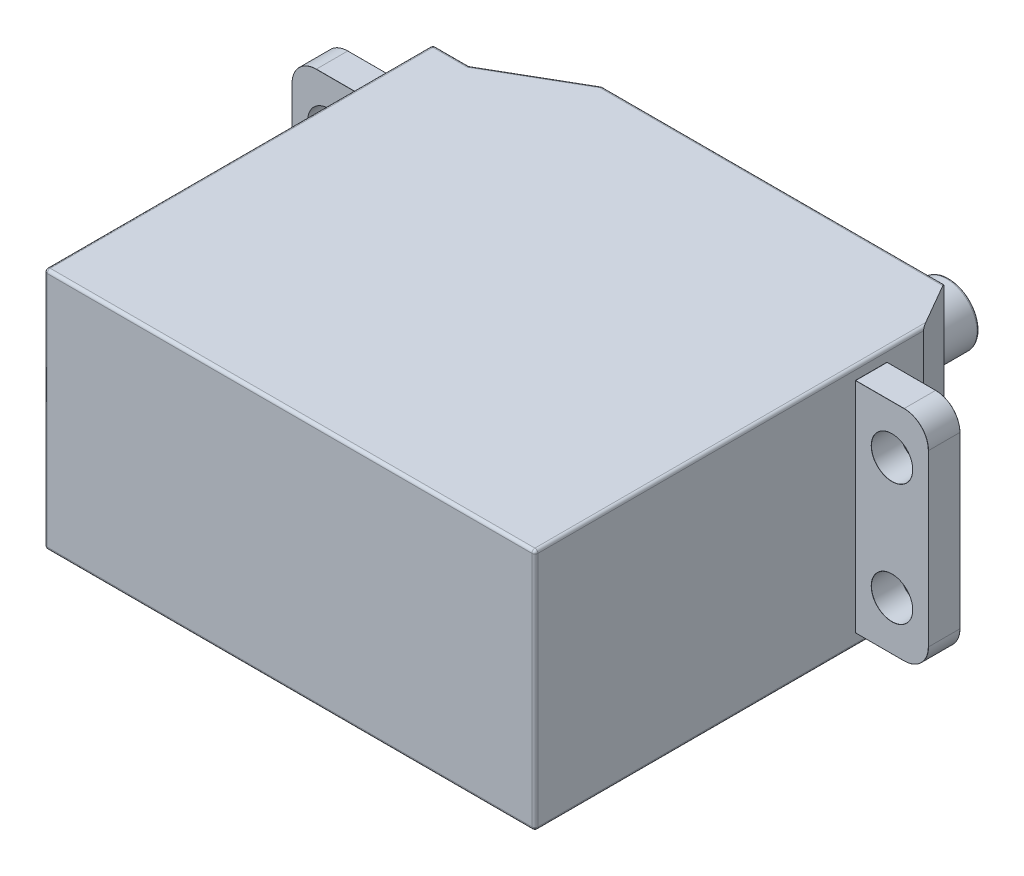
from build123d import *
from OCP.BRepFilletAPI import BRepFilletAPI_MakeChamfer

# Parameters (mm, degrees)
SKETCH_1_W      = 40.4
SKETCH_1_H      = 20
EXTRUDE_1_DEPTH = 32
EXTRUDE_2_DEPTH = 20
SKETCH_4_R      = 1.7
EXTRUDE_3_DEPTH = 2.6
EXTRUDE_4_DEPTH = 0.1
FILLET_2_R      = 0.25
RIB_1_REACH     = 59.245
SKETCH_7_WALL_W = 119.59530404
SKETCH_7_WALL_H = 2
RIB_4_REACH     = 59.245
SKETCH_8_WALL_W = 119.59530404
SKETCH_8_WALL_H = 2
CHAMFER_2_SIZE  = 0.25
CHAMFER_2_SIZE2 = 0.144337567
FILLET2_R       = 0.2
FILLET3_R       = 0.01


with BuildPart() as part:
    # 草图1 → 拉伸1 (new body)
    with BuildSketch(Plane.XY):
        with Locations((20.2, 10)):
            Rectangle(SKETCH_1_W, SKETCH_1_H)
    extrude(amount=EXTRUDE_1_DEPTH)

    # 草图3 → 拉伸2 (add)
    with BuildSketch(Plane(origin=(0, 0, 0), x_dir=(1, 0, 0), z_dir=(0, 1, 0))):
        Polygon((3, 0), (9.92820323, 4), (38.090598923, 4), (40.4, 0), align=None)
    extrude(amount=EXTRUDE_2_DEPTH)

    # 草图4 → 拉伸3 (add)
    # profile 1 of 2: a face of its own
    with BuildSketch(Plane.XY.offset(3)):
        with BuildLine():
            Line((0, 19), (-4, 19))
            ThreePointArc((-4, 19), (-5.414213562, 18.414213562), (-6, 17))
            Line((-6, 17), (-6, 3))
            ThreePointArc((-6, 3), (-5.414213562, 1.585786438), (-4, 1))
            Line((-4, 1), (0, 1))
            Line((0, 1), (0, 19))
        make_face()
        with Locations((-3, 15)):
            Circle(SKETCH_4_R, mode=Mode.SUBTRACT)
        with Locations(Location((-3, 5, 0), (0, 0, 180))):
            Circle(SKETCH_4_R, mode=Mode.SUBTRACT)
    # profile 2 of 2: a face of its own
    with BuildSketch(Plane.XY.offset(3)):
        with BuildLine():
            Line((40.4, 1), (44.4, 1))
            ThreePointArc((44.4, 1), (45.814213562, 1.585786438), (46.4, 3))
            Line((46.4, 3), (46.4, 17))
            ThreePointArc((46.4, 17), (45.814213562, 18.414213562), (44.4, 19))
            Line((44.4, 19), (40.4, 19))
            Line((40.4, 19), (40.4, 1))
        make_face()
        with Locations((43.4, 5)):
            Circle(SKETCH_4_R, mode=Mode.SUBTRACT)
        with Locations(Location((43.4, 15, 0), (0, 0, 180))):
            Circle(SKETCH_4_R, mode=Mode.SUBTRACT)
    extrude(amount=EXTRUDE_3_DEPTH)

    # 草图5 → 拉伸4 (add)
    with BuildSketch(Plane(origin=(0, 0, -4), x_dir=(-1, 0, 0), z_dir=(0, 0, -1))):
        with BuildLine():
            Line((-36.4, 17), (-24.4, 17))
            ThreePointArc((-24.4, 17), (-23.692893219, 16.707106781), (-23.4, 16))
            Line((-23.4, 16), (-23.4, 4))
            ThreePointArc((-23.4, 4), (-23.692893219, 3.292893219), (-24.4, 3))
            Line((-24.4, 3), (-36.4, 3))
            ThreePointArc((-36.4, 3), (-37.107106781, 3.292893219), (-37.4, 4))
            Line((-37.4, 4), (-37.4, 16))
            ThreePointArc((-37.4, 16), (-37.107106781, 16.707106781), (-36.4, 17))
        make_face()
    extrude(amount=EXTRUDE_4_DEPTH)

    # 圆角2
    fillet_2_edges = [part.edges().sort_by_distance(p)[0] for p in [
        (1.5, 0, 0),
        (6.464101615, 0, -2),
        (6.464101615, 20, -2),
        (1.5, 20, 0),
        (0, 10, 0),
        (24.009401077, 0, -4),
        (24.009401077, 20, -4),
        (40.4, 20, 16),
        (40.4, 0, 16),
        (40.4, 10, 32),
        (0, 0, 16),
        (0, 20, 16),
        (20.2, 20, 32),
        (20.2, 0, 32),
        (0, 10, 32),
    ]]
    fillet(fillet_2_edges, radius=FILLET_2_R)

    # 草图7 wall → 筋1 (add, up to next)
    with BuildSketch(Plane(origin=(-1.5, 10, 2.581127792), x_dir=(-0.965925826313, 0, 0.258819045014), z_dir=(0.258819045014, 0, 0.965925826313)), mode=Mode.PRIVATE) as rib_1_sk1:
        Rectangle(SKETCH_7_WALL_W, SKETCH_7_WALL_H)
    rib_1_tool1 = extrude(rib_1_sk1.sketch, amount=RIB_1_REACH, mode=Mode.PRIVATE) - part.part
    add(rib_1_tool1.solids().sort_by_distance((-1.5, 10, 2.581127792))[0])

    # 草图8 wall → 筋4 (add, up to next)
    with BuildSketch(Plane(origin=(41.9, 10, 2.598076212), x_dir=(-0.965925826313, 0, -0.258819045014), z_dir=(-0.258819045014, 0, 0.965925826313)), mode=Mode.PRIVATE) as rib_4_sk1:
        Rectangle(SKETCH_8_WALL_W, SKETCH_8_WALL_H)
    rib_4_tool1 = extrude(rib_4_sk1.sketch, amount=RIB_4_REACH, mode=Mode.PRIVATE) - part.part
    add(rib_4_tool1.solids().sort_by_distance((41.9, 10, 2.598076212))[0])

    # 倒角2: one chamfer whose edges measure the first distance from different faces: ONE call of the kernel's chamfer builder (chamfer() names one face for all edges)
    chamfer_2_edges_1 = [part.edges().sort_by_distance(p)[0] for p in [
        (-4.7, 15, 3),
    ]]
    chamfer_2_side_1 = [part.faces().sort_by_distance(p)[0] for p in [
        (-4.7, 15, 4.3),
    ]]
    chamfer_2_edges_2 = [part.edges().sort_by_distance(p)[0] for p in [
        (-1.3, 5, 3),
    ]]
    chamfer_2_side_2 = [part.faces().sort_by_distance(p)[0] for p in [
        (-1.3, 5, 4.3),
    ]]
    chamfer_2_edges_3 = [part.edges().sort_by_distance(p)[0] for p in [
        (41.7, 5, 3),
    ]]
    chamfer_2_side_3 = [part.faces().sort_by_distance(p)[0] for p in [
        (41.7, 5, 4.3),
    ]]
    chamfer_2_edges_4 = [part.edges().sort_by_distance(p)[0] for p in [
        (45.1, 15, 3),
    ]]
    chamfer_2_side_4 = [part.faces().sort_by_distance(p)[0] for p in [
        (45.1, 15, 4.3),
    ]]
    chamfer_2 = BRepFilletAPI_MakeChamfer(part.part.solid().wrapped)
    for e in chamfer_2_edges_1:
        chamfer_2.Add(CHAMFER_2_SIZE, CHAMFER_2_SIZE2, e.wrapped, chamfer_2_side_1[0].wrapped)  # the first distance lies on this face
    for e in chamfer_2_edges_2:
        chamfer_2.Add(CHAMFER_2_SIZE, CHAMFER_2_SIZE2, e.wrapped, chamfer_2_side_2[0].wrapped)  # the first distance lies on this face
    for e in chamfer_2_edges_3:
        chamfer_2.Add(CHAMFER_2_SIZE, CHAMFER_2_SIZE2, e.wrapped, chamfer_2_side_3[0].wrapped)  # the first distance lies on this face
    for e in chamfer_2_edges_4:
        chamfer_2.Add(CHAMFER_2_SIZE, CHAMFER_2_SIZE2, e.wrapped, chamfer_2_side_4[0].wrapped)  # the first distance lies on this face
    add(Compound.cast(chamfer_2.Shape()), mode=Mode.REPLACE)

    # Sketch1 → Revolve2 (revolve)
    with BuildSketch(Plane(origin=(0, 10, 0), x_dir=(-1, 0, 0), z_dir=(0, 1, 0)), mode=Mode.PRIVATE) as revolve2_sk:
        Polygon((-30.4, -4.1), (-30.4, -12.1), (-32.9, -12.1), (-32.9, -5.1), (-34.4, -5.1), (-35.4, -4.1), align=None)
    revolve(revolve2_sk.sketch.rotate(Axis((30.4, 10, -12.1), (0, 0, 1)), 180), axis=Axis((30.4, 10, -12.1), (0, 0, 1)))

    # Fillet2
    fillet2_edges = [part.edges().sort_by_distance(p)[0] for p in [
        (35.4, 10, -4.1),
        (32.9, 10, -12.1),
        (32.9, 10, -5.1),
        (34.4, 10, -5.1),
    ]]
    fillet(fillet2_edges, radius=FILLET2_R)

    # Fillet3
    fillet3_edges = [part.edges().sort_by_distance(p)[0] for p in [
        (-1.531626181, 9, 2.589602002),
        (-1.531626181, 11, 2.589602002),
        (41.899999999, 9, 2.598076212),
        (41.899999999, 11, 2.598076212),
        (-1.155662433, 5, 3),
        (-4.844337567, 15, 3),
        (45.244337567, 15, 3),
        (41.555662433, 5, 3),
        (-2, 19, 5.6),
        (-5.414213562, 18.414213562, 5.6),
        (-6, 10, 5.6),
        (-5.414213562, 1.585786438, 5.6),
        (-2, 1, 5.6),
        (-2, 19, 3),
        (-5.414213562, 18.414213562, 3),
        (-6, 10, 3),
        (-5.414213562, 1.585786438, 3),
        (-2, 1, 3),
        (45.814213562, 1.585786438, 5.6),
        (46.4, 10, 5.6),
        (45.814213562, 18.414213562, 5.6),
        (42.4, 19, 5.6),
        (42.4, 1, 5.6),
        (45.814213562, 1.585786438, 3),
        (46.4, 10, 3),
        (45.814213562, 18.414213562, 3),
        (42.4, 19, 3),
        (42.4, 1, 3),
        (41.7, 5, 5.6),
        (45.1, 15, 5.6),
    ]]
    fillet(fillet3_edges, radius=FILLET3_R)
    fillet3_2_edges = [part.edges().sort_by_distance(p)[0] for p in [
        (0, 14.995, 3),
        (0, 10, 2.179204004),
        (-3.063252363, 10, 3),
        (0, 11, 2.594778383),
        (-1.512307665, 11, 3),
        (0, 9, 2.594778383),
        (-1.512307665, 9, 3),
        (40.4, 5.005, 3),
        (43.399999998, 10, 3),
        (41.880681483, 11, 3),
        (40.4, 11, 2.603252593),
        (40.4, 9, 2.603252593),
        (41.880681483, 9, 3),
        (40.4, 10, 2.196152424),
        (0, 10, 5.6),
        (0, 5.005, 3),
        (0, 1, 4.3),
        (0, 19, 4.3),
        (40.4, 10, 5.6),
        (40.4, 14.995, 3),
        (40.4, 19, 4.3),
        (40.4, 1, 4.3),
        (40.4, 1.002928932, 3.002928932),
        (40.4, 1.002928932, 5.597071068),
        (40.4, 18.997071068, 3.002928932),
        (40.4, 18.997071068, 5.597071068),
        (0, 18.997071068, 3.002928932),
        (0, 18.997071068, 5.597071068),
        (0, 1.002928932, 3.002928932),
        (0, 1.002928932, 5.597071068),
        (40.4, 10.997071068, 2.199184677),
        (40.4, 9.002928932, 2.199184677),
        (43.388683473, 9.002928932, 3),
        (43.388683473, 10.997071068, 3),
        (-3.051935838, 9.002928932, 3),
        (0, 9.002928932, 2.182236257),
        (-3.051935838, 10.997071068, 3),
        (0, 10.997071068, 2.182236257),
    ]]
    fillet(fillet3_2_edges, radius=FILLET3_R)


solid = part.part
